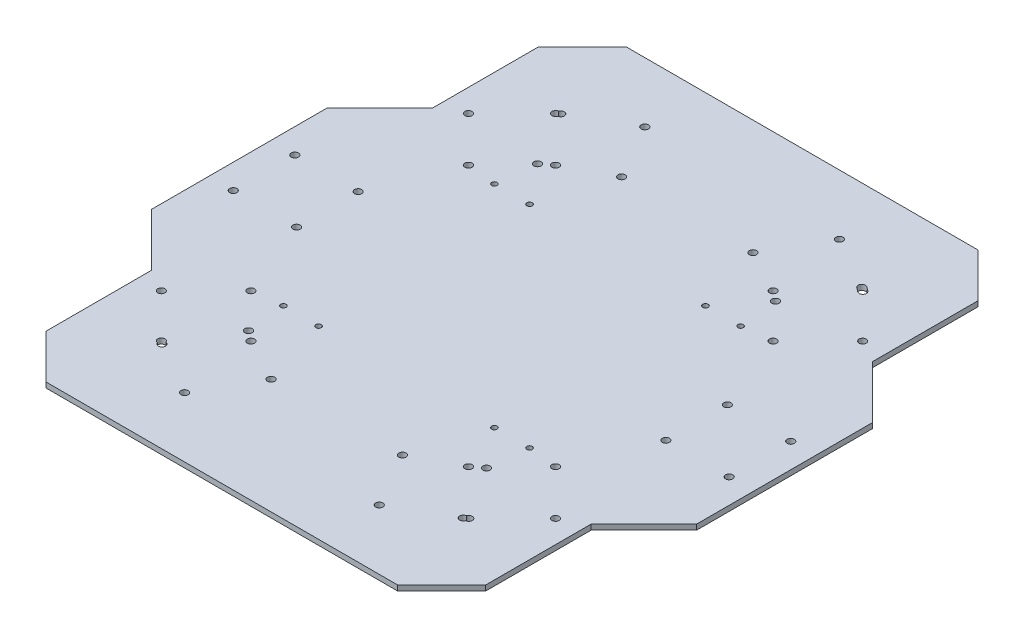
from build123d import *

# Parameters (mm, degrees)
BOSS_EXTRUDE1_DEPTH            = 3
SKETCH2_R                      = 2.05
CUT_EXTRUDE1_DEPTH             = 3
SKETCH5_R                      = 1.55
CUT_EXTRUDE2_DEPTH             = 3
LPATTERN1_COUNT                = 2
LPATTERN1_PITCH                = 120
LPATTERN1_COUNT_DIR2           = 2
LPATTERN1_PITCH_DIR2           = 120
SKETCH6_R                      = 2.05
CUT_EXTRUDE3_DEPTH             = 3
F_4_1_4_1_DIAMETER_SLOT1_DEPTH = 3


# Read off the part's stored shape, not the designer's step: Ø4.1 (4.1) Diameter Slot1
with BuildPart() as part:
    # Sketch1 → Boss-Extrude1 (new body)
    with BuildSketch(Plane(origin=(0, 0, 0), x_dir=(1, 0, 0), z_dir=(0, 1, 0))):
        Polygon((-100, 165), (-125, 140), (-125, 80), (-155, 50), (-155, -50), (-125, -80), (-125, -140), (-100, -165), (100, -165), (125, -140), (125, -80), (155, -50), (155, 50), (125, 80), (125, 140), (100, 165), align=None)
    extrude(amount=BOSS_EXTRUDE1_DEPTH)

    # Sketch2 → Cut-Extrude1 (cut)
    with BuildSketch(Plane(origin=(0, 3, 0), x_dir=(1, 0, 0), z_dir=(0, 1, 0))):
        with Locations(Location((55.344555434, 130.859581934, 0), (0, 0, 270))):
            Circle(SKETCH2_R)
        with Locations(Location((37.344555434, 99.682667397, 0), (0, 0, 270))):
            Circle(SKETCH2_R)
        with Locations(Location((37.344555434, -99.682667397, 0), (0, 0, 270))):
            Circle(SKETCH2_R)
        with Locations(Location((55.344555434, -130.859581934, 0), (0, 0, 270))):
            Circle(SKETCH2_R)
        with Locations(Location((105, 17.5, 0), (0, 0, 270))):
            Circle(SKETCH2_R)
        with Locations(Location((141, 17.5, 0), (0, 0, 270))):
            Circle(SKETCH2_R)
        with Locations(Location((105, -17.5, 0), (0, 0, 270))):
            Circle(SKETCH2_R)
        with Locations(Location((141, -17.5, 0), (0, 0, 270))):
            Circle(SKETCH2_R)
        with Locations(Location((85.655444566, -113.359581934, 0), (0, 0, 270))):
            Circle(SKETCH2_R)
        with Locations(Location((67.655444566, -82.182667397, 0), (0, 0, 270))):
            Circle(SKETCH2_R)
        with Locations(Location((85.655444566, 113.359581934, 0), (0, 0, 270))):
            Circle(SKETCH2_R)
        with Locations(Location((67.655444566, 82.182667397, 0), (0, 0, 270))):
            Circle(SKETCH2_R)
    cut_extrude1 = extrude(amount=-CUT_EXTRUDE1_DEPTH, mode=Mode.SUBTRACT)

    # Mirror1: Cut-Extrude1 across plane
    add(cut_extrude1.mirror(Plane(origin=(0, 0, 0), x_dir=(0, 0, 1), z_dir=(1, 0, 0))), mode=Mode.SUBTRACT)

    # Sketch5 → Cut-Extrude2 (cut)
    with BuildSketch(Plane(origin=(0, 3, 0), x_dir=(1, 0, 0), z_dir=(0, 1, 0))):
        with Locations(Location((50, 60, 0), (0, 0, 270))):
            Circle(SKETCH5_R)
        with Locations(Location((70, 60, 0), (0, 0, 270))):
            Circle(SKETCH5_R)
    cut_extrude2 = extrude(amount=-CUT_EXTRUDE2_DEPTH, mode=Mode.SUBTRACT)

    # LPattern1: Cut-Extrude2 2 × 2
    with Locations(*[(-j * LPATTERN1_PITCH_DIR2, 0, i * LPATTERN1_PITCH) for i in range(LPATTERN1_COUNT) for j in range(LPATTERN1_COUNT_DIR2) if (i, j) != (0, 0)]):
        add(cut_extrude2, mode=Mode.SUBTRACT)

    # Sketch6 → Cut-Extrude3 (cut)
    with BuildSketch(Plane(origin=(0, 3, 0), x_dir=(1, 0, 0), z_dir=(0, 1, 0))):
        with Locations(Location((86.620580695, 61.871843354, 0), (0, 0, 270))):
            Circle(SKETCH6_R)
        with Locations(Location((112.076424818, 87.327687477, 0), (0, 0, 270))):
            Circle(SKETCH6_R)
        with Locations((87.327687477, 112.076424818)):
            Circle(SKETCH6_R)
        with Locations(Location((61.871843354, 86.620580695, 0), (0, 0, 270))):
            Circle(SKETCH6_R)
        with Locations(Location((86.620580695, -61.871843354, 0), (0, 0, 270))):
            Circle(SKETCH6_R)
        with Locations(Location((61.871843354, -86.620580695, 0), (0, 0, 270))):
            Circle(SKETCH6_R)
        with Locations((87.405904998, -111.997966218)):
            Circle(SKETCH6_R)
        with Locations(Location((112.076424818, -87.327687477, 0), (0, 0, 270))):
            Circle(SKETCH6_R)
    cut_extrude3 = extrude(amount=-CUT_EXTRUDE3_DEPTH, mode=Mode.SUBTRACT)

    # Mirror3: Cut-Extrude3 across plane
    add(cut_extrude3.mirror(Plane(origin=(0, 0, 0), x_dir=(0, 0, 1), z_dir=(1, 0, 0))), mode=Mode.SUBTRACT)

    # Ø4.1 (4.1) Diameter Slot1 outline → Ø4.1 (4.1) Diameter Slot1 (cut)
    with BuildSketch(Plane(origin=(0, 0, 0), x_dir=(1, 0, 0), z_dir=(0, 1, 0))):
        with BuildLine():
            Line((86.83706359, 115.034776395), (86.588157233, 115.22576896))
            ThreePointArc((86.588157233, 115.22576896), (83.713821956, 114.847355542), (84.092235374, 111.973020265))
            Line((84.092235374, 111.973020265), (86.392960061, 110.207612121))
            ThreePointArc((86.392960061, 110.207612121), (89.267295338, 110.586025539), (88.88888192, 113.460360816))
            Line((88.88888192, 113.460360816), (88.639975563, 113.651353381))
            ThreePointArc((88.639975563, 113.651353381), (88.529175217, 110.415422949), (85.421153281, 111.323014333))
            ThreePointArc((85.421153281, 111.323014333), (83.740072054, 114.090231054), (86.83706359, 115.034776395))
        make_face()
        with BuildLine():
            Line((88.5093065, 113.751619279), (86.967732653, 114.934510496))
            ThreePointArc((86.967732653, 114.934510496), (87.316446435, 114.561069674), (87.561978762, 114.112992419))
            ThreePointArc((87.561978762, 114.112992419), (88.058336597, 113.991797331), (88.5093065, 113.751619279))
        make_face()
    extrude(amount=F_4_1_4_1_DIAMETER_SLOT1_DEPTH, mode=Mode.SUBTRACT)


solid = part.part
